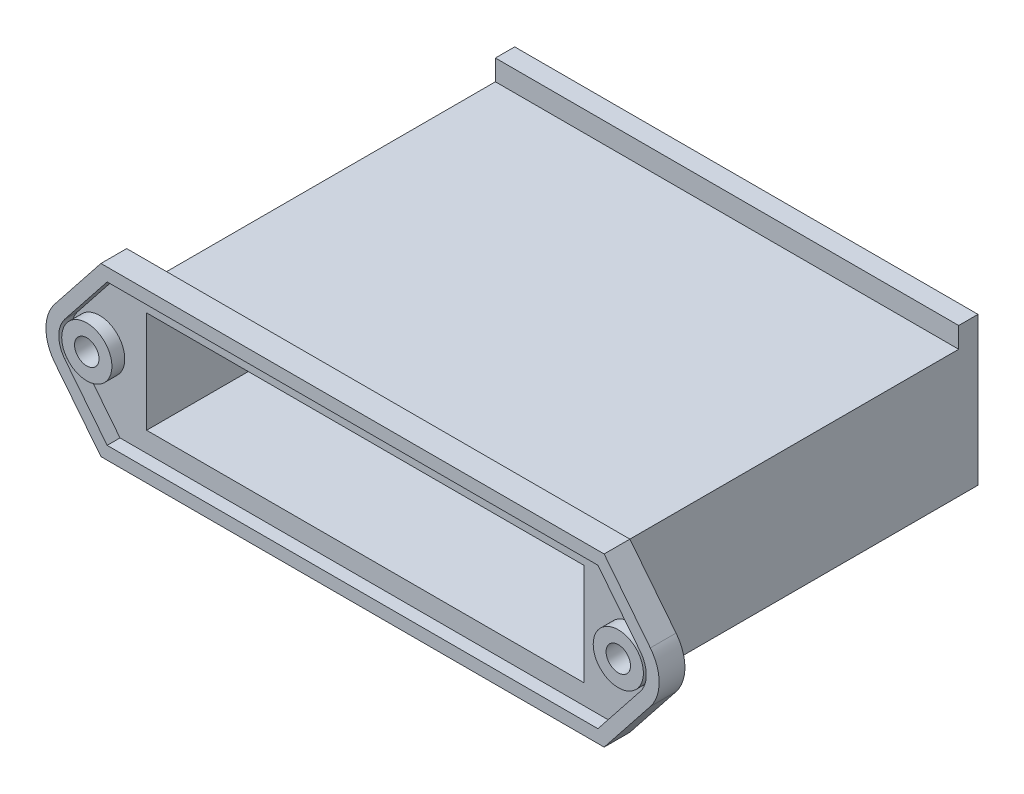
from build123d import *

# Parameters (mm, degrees)
SKETCH1_W           = 72
SKETCH1_H           = 57.2
BOSS_EXTRUDE1_DEPTH = 9.9
SKETCH2_R           = 1.9
BOSS_EXTRUDE2_DEPTH = 4
SKETCH4_W           = 72
SKETCH4_H           = 23
BOSS_EXTRUDE3_DEPTH = 3
SHELL1_START        = -26.6
SHELL1_OUTLINE_W    = 68
SHELL1_OUTLINE_H    = 15.8
SHELL1_DEPTH        = 59.2
SHELL1_START_2      = 30.6
SHELL1_2_OUTLINE_R  = 3.9
SHELL1_2_OUTLINE_W  = 68
SHELL1_2_OUTLINE_H  = 15.8
SHELL1_2_DEPTH      = 2


# Read off the part's stored shape, not the designer's step: Shell1
with BuildPart() as part:
    # Sketch1 → Boss-Extrude1 (new, symmetric)
    with BuildSketch(Plane(origin=(0, 0, 0), x_dir=(1, 0, 0), z_dir=(0, 1, 0))):
        Rectangle(SKETCH1_W, SKETCH1_H)
    extrude(amount=BOSS_EXTRUDE1_DEPTH, both=True)

    # Sketch2 → Boss-Extrude2 (add)
    with BuildSketch(Plane.XY.offset(28.6)):
        with BuildLine():
            Line((-39.1, 13), (39.1, 13))
            Line((39.1, 13), (46.276725004, 3.94394577))
            ThreePointArc((46.276725004, 3.94394577), (47.65, 0), (46.276725004, -3.94394577))
            Line((46.276725004, -3.94394577), (39.1, -13))
            Line((39.1, -13), (-39.1, -13))
            Line((-39.1, -13), (-46.276725004, -3.94394577))
            ThreePointArc((-46.276725004, -3.94394577), (-47.65, 0), (-46.276725004, 3.94394577))
            Line((-46.276725004, 3.94394577), (-39.1, 13))
        make_face()
        with Locations((-41.3, 0)):
            Circle(SKETCH2_R, mode=Mode.SUBTRACT)
        with Locations((41.3, 0)):
            Circle(SKETCH2_R, mode=Mode.SUBTRACT)
    extrude(amount=BOSS_EXTRUDE2_DEPTH)

    # Sketch4 → Boss-Extrude3 (add)
    with BuildSketch(Plane(origin=(0, 0, -28.6), x_dir=(-1, 0, 0), z_dir=(0, 0, -1))):
        with Locations((0, 1.6)):
            Rectangle(SKETCH4_W, SKETCH4_H)
    extrude(amount=-BOSS_EXTRUDE3_DEPTH)

    # Shell1 outline → Shell1 (cut)
    with BuildSketch(Plane.XY.offset(SHELL1_START)):
        Rectangle(SHELL1_OUTLINE_W, SHELL1_OUTLINE_H)
    extrude(amount=SHELL1_DEPTH, mode=Mode.SUBTRACT)

    # Shell1 2 outline → Shell1 2 (cut)
    with BuildSketch(Plane.XY.offset(SHELL1_START_2)):
        with BuildLine():
            Line((-38.133077283, 11), (-44.709252562, 2.701758126))
            ThreePointArc((-44.709252562, 2.701758126), (-45.65, 0), (-44.709252562, -2.701758126))
            Line((-44.709252562, -2.701758126), (-38.133077283, -11))
            Line((-38.133077283, -11), (38.133077283, -11))
            Line((38.133077283, -11), (44.709252562, -2.701758126))
            ThreePointArc((44.709252562, -2.701758126), (45.65, 0), (44.709252562, 2.701758126))
            Line((44.709252562, 2.701758126), (38.133077283, 11))
            Line((38.133077283, 11), (-38.133077283, 11))
        make_face()
        with Locations((-41.3, 0)):
            Circle(SHELL1_2_OUTLINE_R, mode=Mode.SUBTRACT)
        Rectangle(SHELL1_2_OUTLINE_W, SHELL1_2_OUTLINE_H, mode=Mode.SUBTRACT)
        with Locations((41.3, 0)):
            Circle(SHELL1_2_OUTLINE_R, mode=Mode.SUBTRACT)
    extrude(amount=SHELL1_2_DEPTH, mode=Mode.SUBTRACT)


solid = part.part
